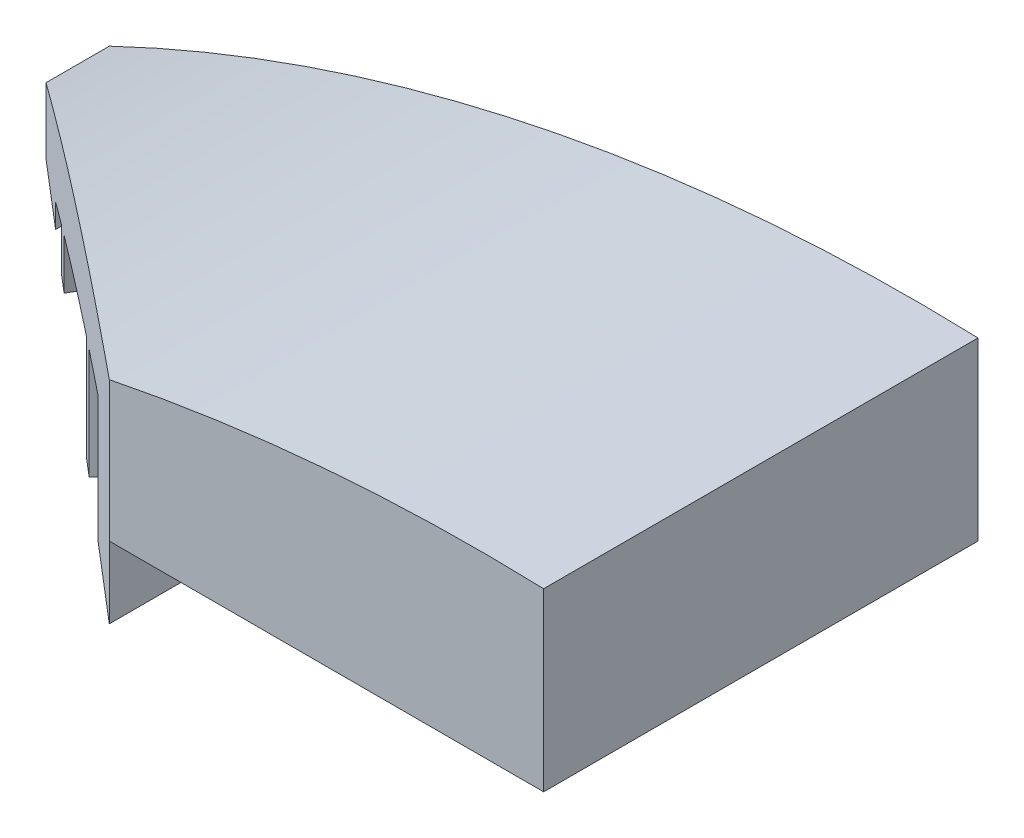
from build123d import *

# Parameters (mm, degrees)
BOSS_EXTRUDE1_DEPTH      = 3.95
SHELL1_START             = -2.75
SHELL1_DEPTH             = 5.5
BOSS_EXTRUDE2_REACH      = 11.943
BOSS_EXTRUDE2_END_RADIUS = 32.700000868
BOSS_EXTRUDE2_START      = 0.02
SKETCH2_R                = 2.3
SKETCH2_R_2              = 1.9
SKETCH3_W                = 6.823927471
SKETCH3_H                = 5.581929969
CUT_EXTRUDE1_DEPTH       = 2.4
BOSS_EXTRUDE3_REACH      = 11.601
BOSS_EXTRUDE3_START      = -0.2
SKETCH4_R                = 2.6
SKETCH4_R_2              = 2.3
CUT_EXTRUDE6_DEPTH       = 10.923471076
CUT_EXTRUDE6_DEPTH_BACK  = 10.923471076


with BuildPart() as part:
    # Sketch1 → Boss-Extrude1 (new, symmetric)
    with BuildSketch(Plane.XY):
        with BuildLine():
            Line((-7.9, 1.037208095), (0, 1.037208095))
            Line((0, 1.037208095), (0, 2.340892579))
            Line((0, 2.340892579), (7.9, 2.340892579))
            Line((7.9, 2.340892579), (7.9, 5.540892579))
            ThreePointArc((7.9, 5.540892579), (-0.199501968, 4.843176285), (-7.9, 2.237208095))
            Line((-7.9, 2.237208095), (-7.9, 1.037208095))
        make_face()
    extrude(amount=BOSS_EXTRUDE1_DEPTH, both=True)

    # Shell1: read off the stored shape, not the designer's step
    # Shell1 outline → Shell1 (cut)
    with BuildSketch(Plane.XY.offset(SHELL1_START)):
        with BuildLine():
            Line((-1.2, 1.037208095), (-1.2, 3.382492095))
            ThreePointArc((-1.2, 3.382492095), (-3.992613389, 2.549753458), (-6.7, 1.471699231))
            Line((-6.7, 1.471699231), (-6.7, 1.037208095))
            Line((-6.7, 1.037208095), (-1.2, 1.037208095))
        make_face()
        with BuildLine():
            ThreePointArc((6.7, 4.360765395), (3.058165542, 4.152993699), (-0.537868318, 3.540892579))
            Line((-0.537868318, 3.540892579), (6.7, 3.540892579))
            Line((6.7, 3.540892579), (6.7, 4.360765395))
        make_face()
    extrude(amount=SHELL1_DEPTH, mode=Mode.SUBTRACT)

    # Boss-Extrude2: up to this cylinder (the profile starts inside it)
    boss_extrude2_end = Plane(origin=(6.738734935, -28.339212532, 2.234946), z_dir=(0, 0, -1)) * Cylinder(BOSS_EXTRUDE2_END_RADIUS, 90.286001737, mode=Mode.PRIVATE)
    # Sketch2 → Boss-Extrude2 (add, up to the surface)
    with BuildSketch(Plane(origin=(0, 1.037208095, 0), x_dir=(-1, 0, 0), z_dir=(0, -1, 0)).offset(BOSS_EXTRUDE2_START), mode=Mode.PRIVATE) as boss_extrude2_sk1:
        with Locations(Location((3.95, 0, 0), (0, 0, 90))):
            Circle(SKETCH2_R)
        with Locations(Location((3.95, 0, 0), (0, 0, 90))):
            Circle(SKETCH2_R_2, mode=Mode.SUBTRACT)
    boss_extrude2_tool1 = extrude(boss_extrude2_sk1.sketch, amount=-BOSS_EXTRUDE2_REACH, mode=Mode.PRIVATE) & boss_extrude2_end
    add(boss_extrude2_tool1.solids().sort_by_distance((-3.95, 1.017208, 2.234946))[0])

    # Sketch3 → Cut-Extrude1 (cut)
    with BuildSketch(Plane.XZ.offset(-2.340892579)):
        with Locations((3.411963736, 0.021143674)):
            Rectangle(SKETCH3_W, SKETCH3_H)
    extrude(amount=-CUT_EXTRUDE1_DEPTH, mode=Mode.SUBTRACT)

    # Sketch4 → Boss-Extrude3 (add, up to next)
    with BuildSketch(Plane(origin=(0, 2.340892579, 0), x_dir=(-1, 0, 0), z_dir=(0, -1, 0)).offset(BOSS_EXTRUDE3_START), mode=Mode.PRIVATE) as boss_extrude3_sk1:
        with Locations(Location((-3.411963735, 0, 0), (0, 0, 90))):
            Circle(SKETCH4_R)
        with Locations(Location((-3.411963735, 0, 0), (0, 0, 90))):
            Circle(SKETCH4_R_2, mode=Mode.SUBTRACT)
    boss_extrude3_tool1 = extrude(boss_extrude3_sk1.sketch, amount=-BOSS_EXTRUDE3_REACH, mode=Mode.PRIVATE) - part.part
    add(boss_extrude3_tool1.solids().sort_by_distance((3.411964, 2.540893, 2.526461))[0])

    # Sketch10 → Cut-Extrude6 (cut, two sides: drawn at the far end of the back side and taken through both)
    with BuildSketch(Plane(origin=(0, 1.037208095, 0), x_dir=(-1, 0, 0), z_dir=(0, -1, 0)).offset(-CUT_EXTRUDE6_DEPTH_BACK)):
        Polygon((7.9, 2.798684465), (0, -3.95), (7.9, -3.95), align=None)
    extrude(amount=CUT_EXTRUDE6_DEPTH + CUT_EXTRUDE6_DEPTH_BACK, mode=Mode.SUBTRACT)


solid = part.part
